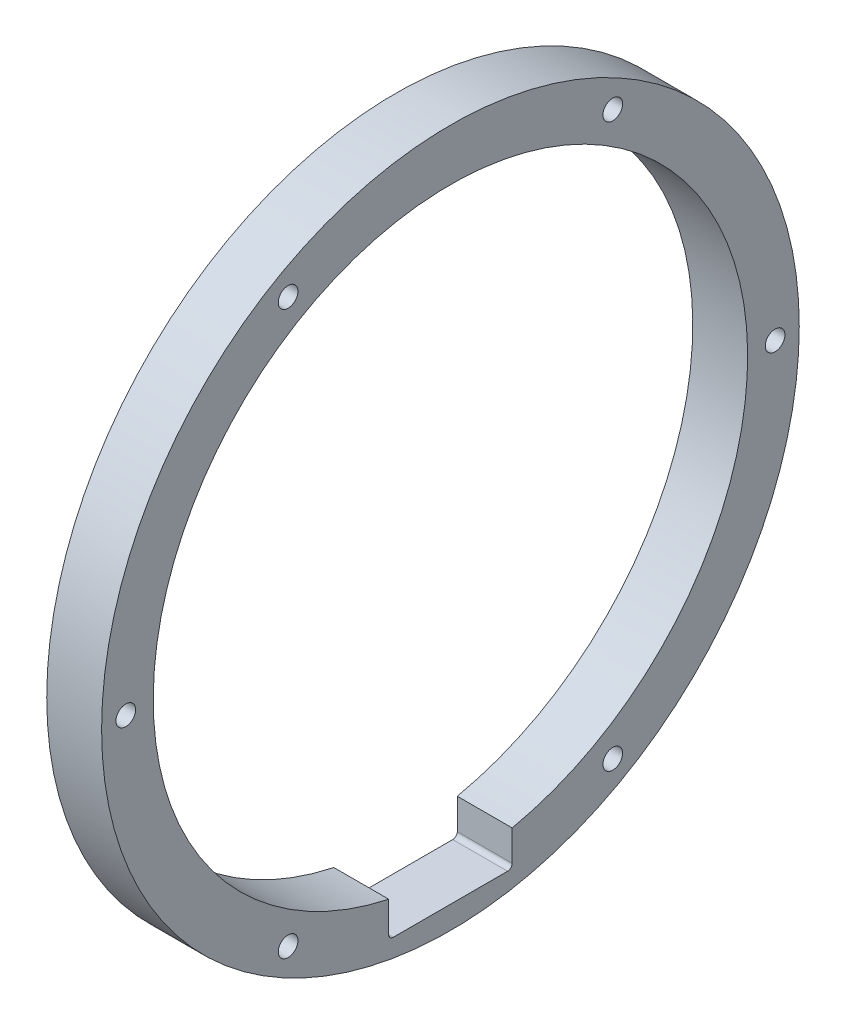
from build123d import *

# Parameters (mm, degrees)
SKETCH1_R           = 76.29
SKETCH1_R_2         = 65
BOSS_EXTRUDE1_DEPTH = 12
CUT_EXTRUDE1_REACH  = 110.556
CUT_EXTRUDE2_REACH  = 110.556
SKETCH3_R           = 2.15


with BuildPart() as part:
    # Sketch1 → Boss-Extrude1 (new body)
    with BuildSketch(Plane(origin=(0, 0, 0), x_dir=(0, 0, -1), z_dir=(1, 0, 0))):
        Circle(SKETCH1_R)
        Circle(SKETCH1_R_2, mode=Mode.SUBTRACT)
    extrude(amount=BOSS_EXTRUDE1_DEPTH)

    # Sketch2 → Cut-Extrude1 (cut, up to next)
    with BuildSketch(Plane(origin=(12, 0, 0), x_dir=(0, 0, -1), z_dir=(1, 0, 0)), mode=Mode.PRIVATE) as cut_extrude1_sk1:
        with BuildLine():
            Line((-13.5, -51.893967527), (13.5, -51.893967527))
            Line((13.5, -51.893967527), (13.5, -70.29))
            ThreePointArc((13.5, -70.29), (13.207106781, -70.997106781), (12.5, -71.29))
            Line((12.5, -71.29), (-12.5, -71.29))
            ThreePointArc((-12.5, -71.29), (-13.207106781, -70.997106781), (-13.5, -70.29))
            Line((-13.5, -70.29), (-13.5, -51.893967527))
        make_face()
    cut_extrude1_tool1 = extrude(cut_extrude1_sk1.sketch, amount=-CUT_EXTRUDE1_REACH, mode=Mode.PRIVATE) & part.part
    add(cut_extrude1_tool1.solids().sort_by_distance((12, -61.584212, 0))[0], mode=Mode.SUBTRACT)

    # Sketch3 → Cut-Extrude2 (cut, up to next)
    with BuildSketch(Plane(origin=(12, 0, 0), x_dir=(0, 0, -1), z_dir=(1, 0, 0)), mode=Mode.PRIVATE) as cut_extrude2_sk1:
        with Locations((-71, 0)):
            Circle(SKETCH3_R)
    cut_extrude2_tool1 = extrude(cut_extrude2_sk1.sketch, amount=-CUT_EXTRUDE2_REACH, mode=Mode.PRIVATE) & part.part
    # Sketch3 → Cut-Extrude2 (cut, up to next)
    with BuildSketch(Plane(origin=(12, 0, 0), x_dir=(0, 0, -1), z_dir=(1, 0, 0)), mode=Mode.PRIVATE) as cut_extrude2_sk2:
        with Locations((-35.5, 61.487803669)):
            Circle(SKETCH3_R)
    cut_extrude2_tool2 = extrude(cut_extrude2_sk2.sketch, amount=-CUT_EXTRUDE2_REACH, mode=Mode.PRIVATE) & part.part
    # Sketch3 → Cut-Extrude2 (cut, up to next)
    with BuildSketch(Plane(origin=(12, 0, 0), x_dir=(0, 0, -1), z_dir=(1, 0, 0)), mode=Mode.PRIVATE) as cut_extrude2_sk3:
        with Locations((35.5, 61.487803669)):
            Circle(SKETCH3_R)
    cut_extrude2_tool3 = extrude(cut_extrude2_sk3.sketch, amount=-CUT_EXTRUDE2_REACH, mode=Mode.PRIVATE) & part.part
    # Sketch3 → Cut-Extrude2 (cut, up to next)
    with BuildSketch(Plane(origin=(12, 0, 0), x_dir=(0, 0, -1), z_dir=(1, 0, 0)), mode=Mode.PRIVATE) as cut_extrude2_sk4:
        with Locations((71, 0)):
            Circle(SKETCH3_R)
    cut_extrude2_tool4 = extrude(cut_extrude2_sk4.sketch, amount=-CUT_EXTRUDE2_REACH, mode=Mode.PRIVATE) & part.part
    # Sketch3 → Cut-Extrude2 (cut, up to next)
    with BuildSketch(Plane(origin=(12, 0, 0), x_dir=(0, 0, -1), z_dir=(1, 0, 0)), mode=Mode.PRIVATE) as cut_extrude2_sk5:
        with Locations((35.5, -61.487803669)):
            Circle(SKETCH3_R)
    cut_extrude2_tool5 = extrude(cut_extrude2_sk5.sketch, amount=-CUT_EXTRUDE2_REACH, mode=Mode.PRIVATE) & part.part
    # Sketch3 → Cut-Extrude2 (cut, up to next)
    with BuildSketch(Plane(origin=(12, 0, 0), x_dir=(0, 0, -1), z_dir=(1, 0, 0)), mode=Mode.PRIVATE) as cut_extrude2_sk6:
        with Locations((-35.5, -61.487803669)):
            Circle(SKETCH3_R)
    cut_extrude2_tool6 = extrude(cut_extrude2_sk6.sketch, amount=-CUT_EXTRUDE2_REACH, mode=Mode.PRIVATE) & part.part
    add(cut_extrude2_tool1.solids().sort_by_distance((12, 0, 71))[0], mode=Mode.SUBTRACT)
    add(cut_extrude2_tool2.solids().sort_by_distance((12, 61.487804, 35.5))[0], mode=Mode.SUBTRACT)
    add(cut_extrude2_tool3.solids().sort_by_distance((12, 61.487804, -35.5))[0], mode=Mode.SUBTRACT)
    add(cut_extrude2_tool4.solids().sort_by_distance((12, 0, -71))[0], mode=Mode.SUBTRACT)
    add(cut_extrude2_tool5.solids().sort_by_distance((12, -61.487804, -35.5))[0], mode=Mode.SUBTRACT)
    add(cut_extrude2_tool6.solids().sort_by_distance((12, -61.487804, 35.5))[0], mode=Mode.SUBTRACT)


solid = part.part
